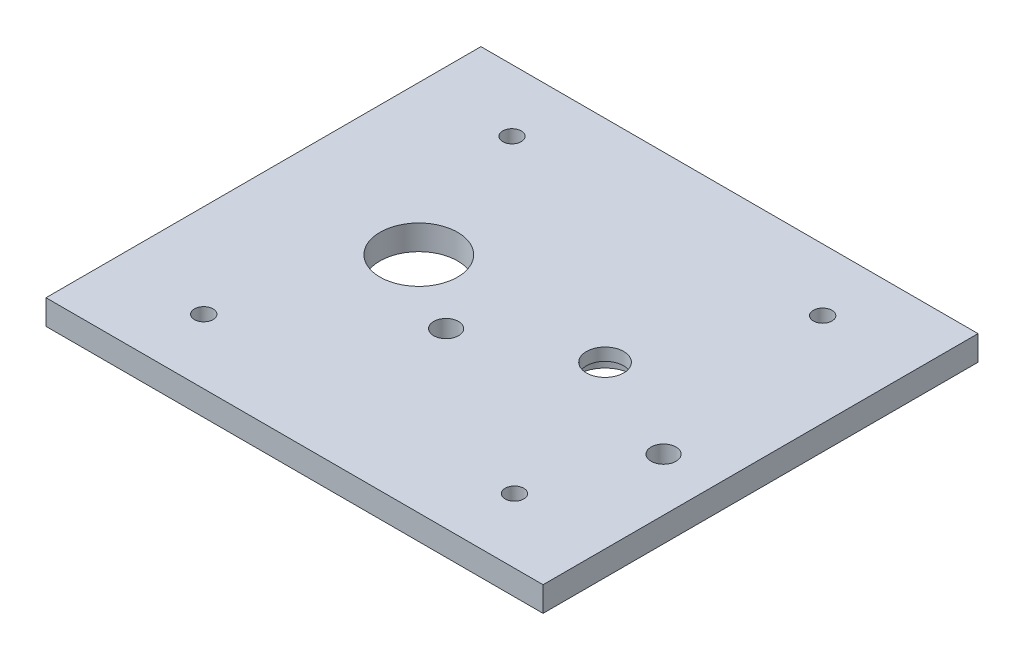
from build123d import *

# Parameters (mm, degrees)
SKETCH1_W           = 80
SKETCH1_H           = 70
SKETCH1_R           = 1.5
SKETCH1_R_2         = 2
SKETCH1_R_3         = 6.25
SKETCH1_R_4         = 3
BOSS_EXTRUDE4_DEPTH = 4
SKETCH1_7_R         = 4.5
CUT_EXTRUDE2_DEPTH  = 2


with BuildPart() as part:
    # Sketch1 → Boss-Extrude4 (new body)
    with BuildSketch(Plane(origin=(0, 0, 0), x_dir=(1, 0, 0), z_dir=(0, 1, 0))):
        Rectangle(SKETCH1_W, SKETCH1_H)
        with Locations((-25, -24.60667729)):
            Circle(SKETCH1_R, mode=Mode.SUBTRACT)
        with Locations((25, -24.60667729)):
            Circle(SKETCH1_R, mode=Mode.SUBTRACT)
        with Locations((31.5, -7.102660735)):
            Circle(SKETCH1_R_2, mode=Mode.SUBTRACT)
        with Locations((-25, 25)):
            Circle(SKETCH1_R, mode=Mode.SUBTRACT)
        with Locations((25, 25)):
            Circle(SKETCH1_R, mode=Mode.SUBTRACT)
        with Locations((-16, 1)):
            Circle(SKETCH1_R_3, mode=Mode.SUBTRACT)
        with Locations((-3.5, -7.102660735)):
            Circle(SKETCH1_R_2, mode=Mode.SUBTRACT)
        with Locations((13.978339488, 0.999882702)):
            Circle(SKETCH1_R_4, mode=Mode.SUBTRACT)
    extrude(amount=BOSS_EXTRUDE4_DEPTH)

    # Sketch1<7> → Cut-Extrude2 (cut)
    with BuildSketch(Plane(origin=(0, 0, 0), x_dir=(1, 0, 0), z_dir=(0, 1, 0))):
        with Locations((13.978339488, 0.999882702)):
            Circle(SKETCH1_7_R)
    extrude(amount=CUT_EXTRUDE2_DEPTH, mode=Mode.SUBTRACT)


solid = part.part
